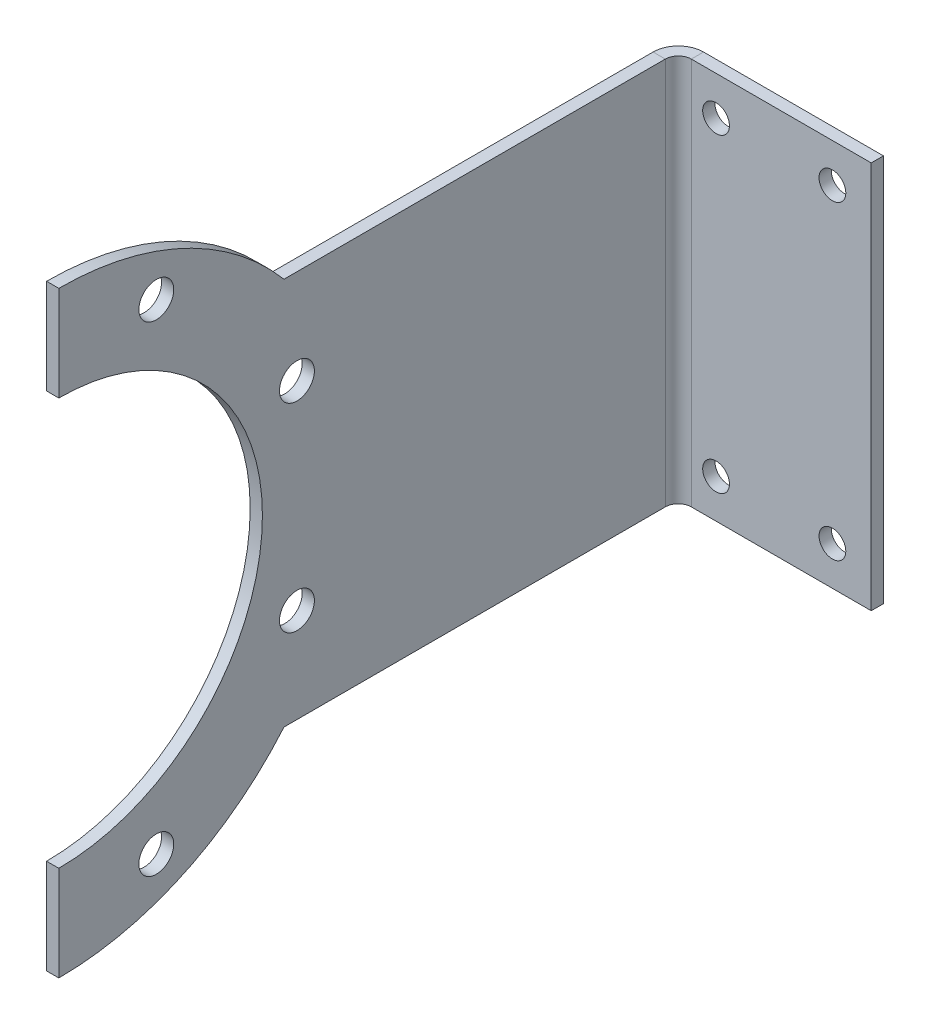
from build123d import *

# Parameters (mm, degrees)
SKETCH1_R                  = 2.25
SKETCH1_R_2                = 1.725
BASE_FLANGE1_DEPTH         = 1.5748
SKETCHED_START             = 0.25
SKETCHED_BEND1_OUTLINE_W   = 50
SKETCHED_BEND1_OUTLINE_H   = 1.5748
SKETCHED_BEND1_DEPTH       = 78.867027748
SKETCHED_START_2           = 78.810179492
SKETCHED_BEND1_2_OUTLINE_R = 2.25
SKETCHED_BEND1_2_DEPTH     = 3.2512
SKETCHED_START_3           = -39
SKETCHED_BEND1_3_DEPTH     = 78


with BuildPart() as part:
    # Base-Flange1: sheet metal written as solids
    # Sketch1 → Base-Flange1 (new body)
    with BuildSketch(Plane.XY):
        with BuildLine():
            Line((0.25, 38.499188303), (0.25, 26.248809497))
            ThreePointArc((0.25, 26.248809497), (26.498809497, 0), (0.25, -26.248809497))
            Line((0.25, -26.248809497), (0.25, -38.499188303))
            ThreePointArc((0.25, -38.499188303), (16.257038834, -34.95934997), (29.278831944, -25))
            Line((29.278831944, -25), (80.25, -25))
            Line((80.25, -25), (105.25, -25))
            Line((105.25, -25), (105.25, 25))
            Line((105.25, 25), (80.25, 25))
            Line((80.25, 25), (29.278831944, 25))
            ThreePointArc((29.278831944, 25), (16.257038834, 34.95934997), (0.25, 38.499188303))
        make_face()
        with Locations((12.819894984, 30.949964339)):
            Circle(SKETCH1_R, mode=Mode.SUBTRACT)
        with Locations((30.949964339, 12.819894984)):
            Circle(SKETCH1_R, mode=Mode.SUBTRACT)
        with Locations((30.949964339, -12.819894984)):
            Circle(SKETCH1_R, mode=Mode.SUBTRACT)
        with Locations((12.819894984, -30.949964339)):
            Circle(SKETCH1_R, mode=Mode.SUBTRACT)
        with Locations((100.25, 20)):
            Circle(SKETCH1_R_2, mode=Mode.SUBTRACT)
        with Locations((85.25, 20)):
            Circle(SKETCH1_R_2, mode=Mode.SUBTRACT)
        with Locations((85.25, -20)):
            Circle(SKETCH1_R_2, mode=Mode.SUBTRACT)
        with Locations((100.25, -20)):
            Circle(SKETCH1_R_2, mode=Mode.SUBTRACT)
    extrude(amount=-BASE_FLANGE1_DEPTH)

    # Sketched Bend1: read off the stored shape, not the designer's step
    # Sketched Bend1 outline → Sketched Bend1 (cut)
    with BuildSketch(Plane.YZ.offset(SKETCHED_START)):
        with Locations((0, -0.7874)):
            Rectangle(SKETCHED_BEND1_OUTLINE_W, SKETCHED_BEND1_OUTLINE_H)
    extrude(amount=SKETCHED_BEND1_DEPTH, mode=Mode.SUBTRACT)

    # Sketched Bend1 2 outline → Sketched Bend1 2 (add)
    with BuildSketch(Plane.YZ.offset(SKETCHED_START_2)):
        with BuildLine():
            Line((25, 0), (25, 50.836188564))
            ThreePointArc((25, 50.836188564), (34.95934997, 63.857981674), (38.499188303, 79.865020508))
            Line((38.499188303, 79.865020508), (26.248809497, 79.865020508))
            ThreePointArc((26.248809497, 79.865020508), (0, 53.616211011), (-26.248809497, 79.865020508))
            Line((-26.248809497, 79.865020508), (-38.499188303, 79.865020508))
            ThreePointArc((-38.499188303, 79.865020508), (-34.95934997, 63.857981674), (-25, 50.836188564))
            Line((-25, 50.836188564), (-25, 0))
            Line((-25, 0), (25, 0))
        make_face()
        with Locations((-12.819894984, 49.165056169)):
            Circle(SKETCHED_BEND1_2_OUTLINE_R, mode=Mode.SUBTRACT)
        with Locations((-30.949964339, 67.295125524)):
            Circle(SKETCHED_BEND1_2_OUTLINE_R, mode=Mode.SUBTRACT)
        with Locations((12.819894984, 49.165056169)):
            Circle(SKETCHED_BEND1_2_OUTLINE_R, mode=Mode.SUBTRACT)
        with Locations((30.949964339, 67.295125524)):
            Circle(SKETCHED_BEND1_2_OUTLINE_R, mode=Mode.SUBTRACT)
    extrude(amount=SKETCHED_BEND1_2_DEPTH)

    # Sketched Bend1 3 outline → Sketched Bend1 3 (cut)
    with BuildSketch(Plane(origin=(0, 0, 0), x_dir=(1, 0, 0), z_dir=(0, 1, 0)).offset(SKETCHED_START_3)):
        with BuildLine():
            ThreePointArc((82.061379492, 0), (80.875985684, -0.491006192), (80.384979492, -1.6764))
            Line((80.384979492, -1.6764), (80.384979492, -79.865020508))
            Line((80.384979492, -79.865020508), (82.061379492, -79.865020508))
            Line((82.061379492, -79.865020508), (82.061379492, 0))
        make_face()
        with BuildLine():
            Line((78.810179493, -81), (78.810179492, -1.6764))
            ThreePointArc((78.810179492, -1.6764), (79.762433925, 0.622545567), (82.061379492, 1.5748))
            Line((82.061379492, 1.5748), (84, 1.5748))
            Line((84, 1.5748), (84, 3))
            Line((84, 3), (-1, 3))
            Line((-1, 3), (-1, -81))
            Line((-1, -81), (78.810179493, -81))
        make_face()
    extrude(amount=SKETCHED_BEND1_3_DEPTH, mode=Mode.SUBTRACT)


solid = part.part
